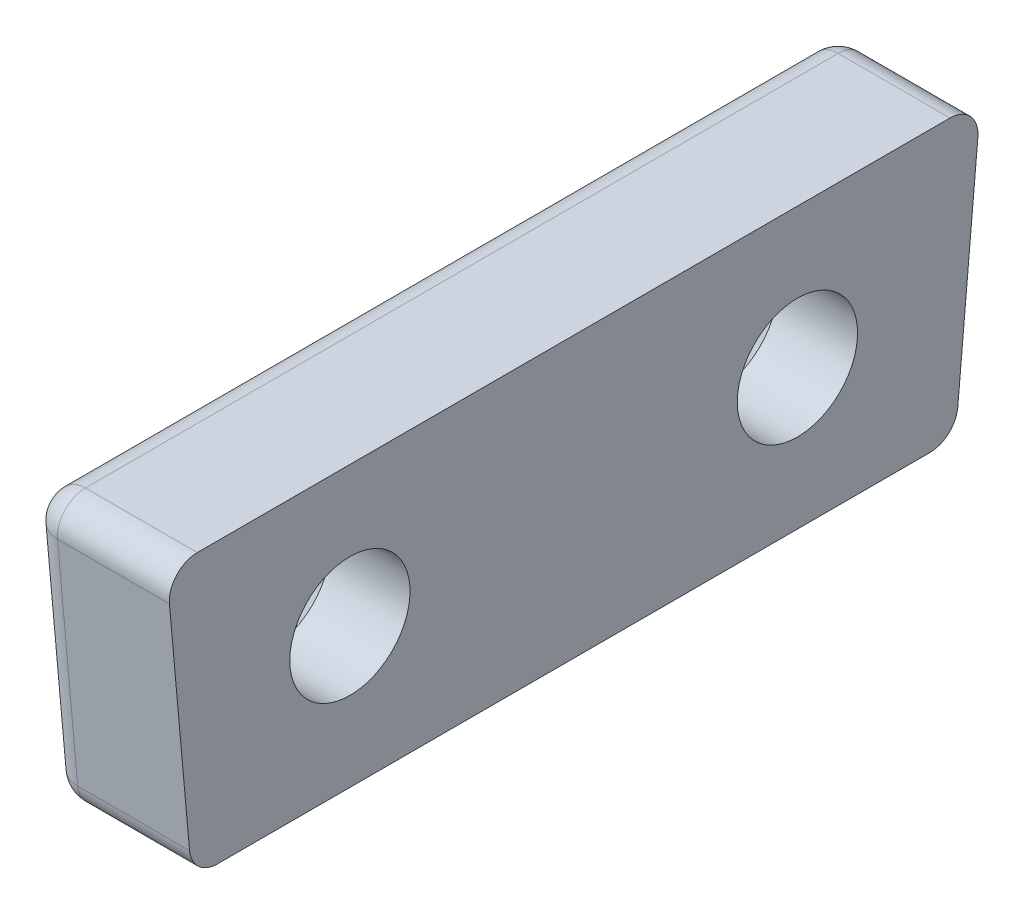
from build123d import *

# Parameters (mm, degrees)
EXTRUDE_1_DEPTH              = 5
HOLE_WIZARD_M4_1_D           = 4.3
HOLE_WIZARD_M4_1_CSINK_D     = 8.6
HOLE_WIZARD_M4_1_CSINK_ANGLE = 90
FILLET_1_R                   = 1


with BuildPart() as part:
    # 草图1 → 凸台-拉伸1 (new body)
    with BuildSketch(Plane(origin=(0, 0, 0), x_dir=(0, 0, -1), z_dir=(1, 0, 0))):
        Polygon((22, 18), (15.44969994, 18), (16.349099819, 8), (43.650900181, 8), (44.55030006, 18), (38, 18), align=None)
    extrude(amount=EXTRUDE_1_DEPTH)

    # M4 十字槽沉头木螺钉的锥形沉头孔1 (through all)
    with Locations(Plane.ZY):
        with Locations((-38, 13), (-22, 13)):
            CounterSinkHole(HOLE_WIZARD_M4_1_D / 2, HOLE_WIZARD_M4_1_CSINK_D / 2, counter_sink_angle=HOLE_WIZARD_M4_1_CSINK_ANGLE)

    # 圆角1
    # the kernel refuses this fillet: 1 mm, written as the material it takes off along each edge
    with BuildSketch(Plane(origin=(1, 9, -17.263196285), x_dir=(0, -0.08957840876297431, 0.9959797732301061), z_dir=(-1, 0, 0))) as fillet_1_piece_1_section:
        Polygon((0, 0), (FILLET_1_R, 0), (FILLET_1_R, -FILLET_1_R * 0.914096466321), (FILLET_1_R * 0.089578408763, -FILLET_1_R * 0.99597977323), align=None)
    fillet_1_piece_1 = extrude(amount=FILLET_1_R, mode=Mode.PRIVATE)
    fillet_1_piece_1 = fillet_1_piece_1 - Plane(origin=(1, 9, -17.263196285), x_dir=(0, 0.7380983703961737, -0.6746931121765753), z_dir=(-1, 0, 0)) * Sphere(FILLET_1_R, mode=Mode.PRIVATE)
    add(fillet_1_piece_1, mode=Mode.SUBTRACT)
    with BuildSketch(Plane(origin=(1, 9, -42.736803715), x_dir=(0, -1, 0), z_dir=(-1, 0, 0))) as fillet_1_piece_2_section:
        Polygon((0, 0), (FILLET_1_R, 0), (FILLET_1_R, -FILLET_1_R * 0.914096466321), (FILLET_1_R * 0.089578408763, -FILLET_1_R * 0.99597977323), align=None)
    fillet_1_piece_2 = extrude(amount=FILLET_1_R, mode=Mode.PRIVATE)
    fillet_1_piece_2 = fillet_1_piece_2 - Plane(origin=(1, 9, -42.736803715), x_dir=(0, 0.7380983703961737, 0.6746931121765753), z_dir=(-1, 0, 0)) * Sphere(FILLET_1_R, mode=Mode.PRIVATE)
    add(fillet_1_piece_2, mode=Mode.SUBTRACT)
    with BuildSketch(Plane(origin=(1, 17, -16.543676382), x_dir=(0, -0.08957840876297431, 0.9959797732301061), z_dir=(-1, 0, 0))) as fillet_1_piece_3_section:
        Polygon((0, 0), (FILLET_1_R, 0), (FILLET_1_R, FILLET_1_R * 1.09397644214), (-FILLET_1_R * 0.089578408763, FILLET_1_R * 0.99597977323), align=None)
    fillet_1_piece_3 = extrude(amount=FILLET_1_R, mode=Mode.PRIVATE)
    fillet_1_piece_3 = fillet_1_piece_3 - Plane(origin=(1, 17, -16.543676382), x_dir=(0, -0.6746931121765753, -0.7380983703961737), z_dir=(-1, 0, 0)) * Sphere(FILLET_1_R, mode=Mode.PRIVATE)
    add(fillet_1_piece_3, mode=Mode.SUBTRACT)
    with BuildSketch(Plane(origin=(1, 17, -43.456323618), x_dir=(0, -0.08957840876297431, -0.9959797732301061), z_dir=(-1, 0, 0))) as fillet_1_piece_4_section:
        Polygon((0, 0), (FILLET_1_R, 0), (FILLET_1_R, -FILLET_1_R * 1.09397644214), (-FILLET_1_R * 0.089578408763, -FILLET_1_R * 0.99597977323), align=None)
    fillet_1_piece_4 = extrude(amount=FILLET_1_R, mode=Mode.PRIVATE)
    fillet_1_piece_4 = fillet_1_piece_4 - Plane(origin=(1, 17, -43.456323618), x_dir=(0, -0.6746931121765753, 0.7380983703961737), z_dir=(-1, 0, 0)) * Sphere(FILLET_1_R, mode=Mode.PRIVATE)
    add(fillet_1_piece_4, mode=Mode.SUBTRACT)
    with BuildSketch(Plane(origin=(0, 8, -17.263196285), x_dir=(1, 0, 0), z_dir=(0, 0, -1))) as fillet_1_piece_5:
        with BuildLine():
            CenterArc((FILLET_1_R, -FILLET_1_R), FILLET_1_R, 90, 90)
            Line((0, -FILLET_1_R), (0, 0))
            Line((0, 0), (FILLET_1_R, 0))
        make_face()
    extrude(amount=25.47360743, mode=Mode.SUBTRACT)
    with BuildSketch(Plane(origin=(0, 16.910421591, -15.547696608), x_dir=(0, 0.08957840876297431, -0.9959797732301061), z_dir=(0, -0.9959797732301061, -0.08957840876297431))) as fillet_1_piece_6:
        with BuildLine():
            CenterArc((FILLET_1_R, FILLET_1_R), FILLET_1_R, 180, 90)
            Line((0, FILLET_1_R), (0, 0))
            Line((0, 0), (FILLET_1_R, 0))
        make_face()
    extrude(amount=8.032291634, mode=Mode.SUBTRACT)
    with BuildSketch(Plane(origin=(0, 18, -43.456323618), x_dir=(1, 0, 0), z_dir=(0, 0, 1))) as fillet_1_piece_7:
        with BuildLine():
            CenterArc((FILLET_1_R, -FILLET_1_R), FILLET_1_R, 90, 90)
            Line((0, -FILLET_1_R), (0, 0))
            Line((0, 0), (FILLET_1_R, 0))
        make_face()
    extrude(amount=26.912647237, mode=Mode.SUBTRACT)
    with BuildSketch(Plane(origin=(0, 8.910421591, -43.732783488), x_dir=(1, 0, 0), z_dir=(0, 0.9959797732301061, -0.08957840876297431))) as fillet_1_piece_8:
        with BuildLine():
            CenterArc((FILLET_1_R, -FILLET_1_R), FILLET_1_R, 90, 90)
            Line((0, -FILLET_1_R), (0, 0))
            Line((0, 0), (FILLET_1_R, 0))
        make_face()
    extrude(amount=8.032291634, mode=Mode.SUBTRACT)
    with BuildSketch(Plane(origin=(1, 8, -43.650900181), x_dir=(0, 0, 1), z_dir=(1, 0, 0))) as fillet_1_piece_9:
        with BuildLine():
            CenterArc((FILLET_1_R * 0.914096466321, -FILLET_1_R), FILLET_1_R, 90, 84.860646272)
            Line((-FILLET_1_R * 0.0818833069089, -FILLET_1_R * 0.910421591237), (0, 0))
            Line((0, 0), (FILLET_1_R * 0.914096466321, 0))
        make_face()
    extrude(amount=6.285241166, mode=Mode.SUBTRACT)
    with BuildSketch(Plane(origin=(1, 8, -16.349099819), x_dir=(0, 0, -1), z_dir=(1, 0, 0))) as fillet_1_piece_10:
        with BuildLine():
            CenterArc((FILLET_1_R * 0.914096466321, FILLET_1_R), FILLET_1_R, 185.139353728, 84.860646272)
            Line((-FILLET_1_R * 0.0818833069089, FILLET_1_R * 0.910421591237), (0, 0))
            Line((0, 0), (FILLET_1_R * 0.914096466321, 0))
        make_face()
    extrude(amount=6.285241166, mode=Mode.SUBTRACT)
    with BuildSketch(Plane(origin=(1, 18, -15.44969994), x_dir=(0, 0, -1), z_dir=(1, 0, 0))) as fillet_1_piece_11:
        with BuildLine():
            CenterArc((FILLET_1_R * 1.09397644214, -FILLET_1_R), FILLET_1_R, 90, 95.139353728)
            Line((FILLET_1_R * 0.0979966689112, -FILLET_1_R * 1.08957840876), (0, 0))
            Line((0, 0), (FILLET_1_R * 1.09397644214, 0))
        make_face()
    extrude(amount=6.734941105, mode=Mode.SUBTRACT)
    with BuildSketch(Plane(origin=(1, 18, -44.55030006), x_dir=(0, 0, 1), z_dir=(1, 0, 0))) as fillet_1_piece_12:
        with BuildLine():
            CenterArc((FILLET_1_R * 1.09397644214, FILLET_1_R), FILLET_1_R, 174.860646272, 95.139353728)
            Line((FILLET_1_R * 0.0979966689112, FILLET_1_R * 1.08957840876), (0, 0))
            Line((0, 0), (FILLET_1_R * 1.09397644214, 0))
        make_face()
    extrude(amount=6.734941105, mode=Mode.SUBTRACT)


solid = part.part
